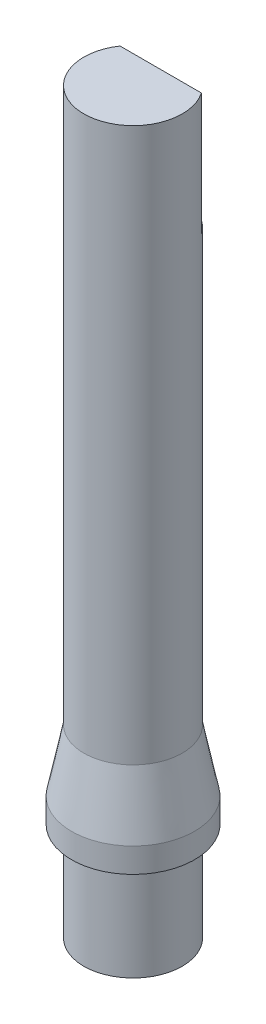
from build123d import *

# Parameters (mm, degrees)
SKETCH1_R           = 4
BOSS_EXTRUDE1_DEPTH = 60
SKETCH2_R           = 5
BOSS_EXTRUDE2_DEPTH = 2
CHAMFER1_SIZE       = 1
CHAMFER1_SIZE_2     = 5
CUT_EXTRUDE1_START  = -10
CUT_EXTRUDE1_DEPTH  = 10


with BuildPart() as part:
    # Sketch1 → Boss-Extrude1 (new body)
    with BuildSketch(Plane(origin=(0, 0, 0), x_dir=(1, 0, 0), z_dir=(0, 1, 0))):
        with Locations(Location((0, 0, 0), (0, 0, 270))):
            Circle(SKETCH1_R)
    extrude(amount=BOSS_EXTRUDE1_DEPTH)

    # Sketch2 → Boss-Extrude2 (add)
    with BuildSketch(Plane(origin=(0, 8, 0), x_dir=(-1, 0, 0), z_dir=(0, -1, 0))):
        with Locations(Location((0, 0, 0), (0, 0, 90))):
            Circle(SKETCH2_R)
    extrude(amount=-BOSS_EXTRUDE2_DEPTH)

    # Chamfer1
    # the kernel refuses this chamfer: 5, 1 mm, written as the material it adds along each edge
    with BuildSketch(Plane(origin=(0, 10, 0), x_dir=(0, 0, 1), z_dir=(1, 0, 0))) as chamfer1_piece_1_section:
        Polygon((4 + CHAMFER1_SIZE, 0), (4, -CHAMFER1_SIZE_2), (4, 0), align=None)
    chamfer1_piece_1 = revolve(axis=Axis((0, 10, 0), (0, -1, 0)), mode=Mode.PRIVATE)
    chamfer1_piece_1 = chamfer1_piece_1 & Plane(origin=(0, 12.589419048, 0), x_dir=(0, 0, -1), z_dir=(0, -1, 0)) * Cylinder(5, 20, mode=Mode.PRIVATE)
    add(chamfer1_piece_1)

    # Sketch3 → Cut-Extrude1 (cut)
    with BuildSketch(Plane(origin=(0, 60, 0), x_dir=(1, 0, 0), z_dir=(0, 1, 0)).offset(CUT_EXTRUDE1_START)):
        with BuildLine():
            Line((-3.307189139, 2.25), (3.307189139, 2.25))
            ThreePointArc((3.307189139, 2.25), (0, 4), (-3.307189139, 2.25))
        make_face()
    extrude(amount=CUT_EXTRUDE1_DEPTH, mode=Mode.SUBTRACT)


solid = part.part
